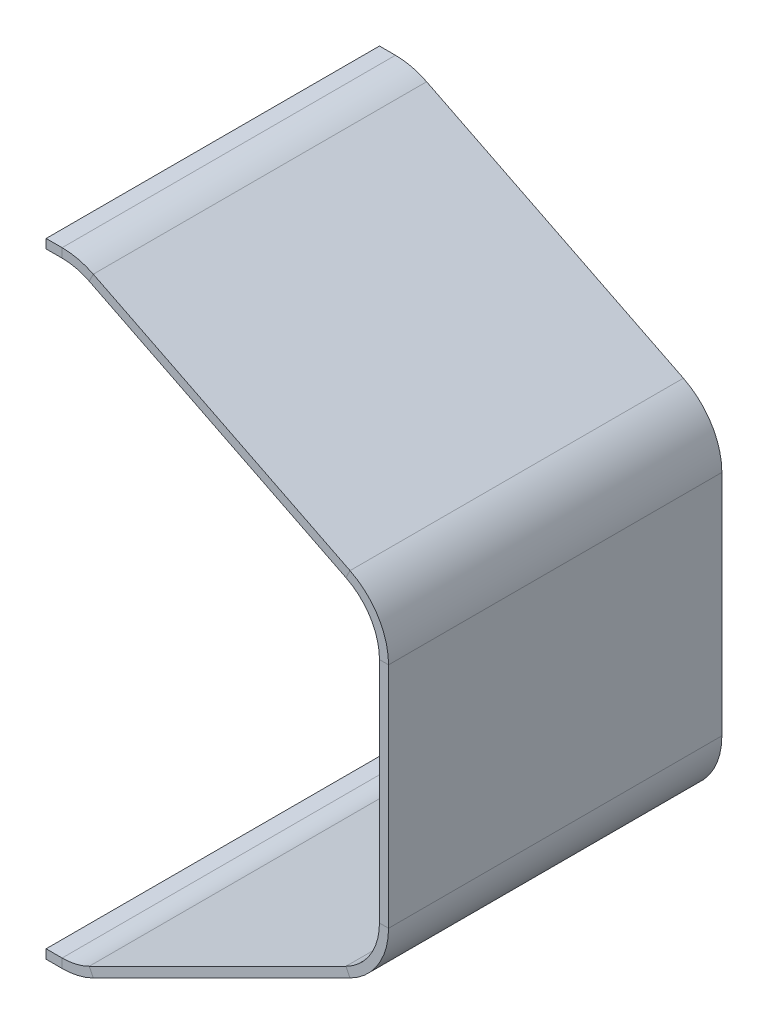
from build123d import *

# Parameters (mm, degrees)
BASE_FLANGE1_DEPTH = 55


# Sheet-metal steps are written as plain solids
with BuildPart() as part:
    # Sketch1 → Base-Flange1 (new body)
    with BuildSketch(Plane.XY):
        with BuildLine():
            Line((0, -50), (2.639320225, -50))
            ThreePointArc((2.639320225, -50), (4.93684943, -49.732489895), (7.11145618, -48.94427191))
            Line((7.11145618, -48.94427191), (49.472135955, -27.763932023))
            ThreePointArc((49.472135955, -27.763932023), (53.506508084, -24.076971234), (55, -18.819660113))
            Line((55, -18.819660113), (55, 18.819660113))
            ThreePointArc((55, 18.819660113), (53.506508084, 24.076971234), (49.472135955, 27.763932023))
            Line((49.472135955, 27.763932023), (7.11145618, 48.94427191))
            ThreePointArc((7.11145618, 48.94427191), (4.93684943, 49.732489895), (2.639320225, 50))
            Line((2.639320225, 50), (0, 50))
            Line((0, 50), (0, 51.5))
            Line((0, 51.5), (2.639320225, 51.5))
            ThreePointArc((2.639320225, 51.5), (5.281478811, 51.192363379), (7.782276573, 50.285912696))
            Line((7.782276573, 50.285912696), (50.142956348, 29.105572809))
            ThreePointArc((50.142956348, 29.105572809), (54.782484296, 24.865567902), (56.5, 18.819660113))
            Line((56.5, 18.819660113), (56.5, -18.819660113))
            ThreePointArc((56.5, -18.819660113), (54.782484296, -24.865567902), (50.142956348, -29.105572809))
            Line((50.142956348, -29.105572809), (7.782276573, -50.285912696))
            ThreePointArc((7.782276573, -50.285912696), (5.281478811, -51.192363379), (2.639320225, -51.5))
            Line((2.639320225, -51.5), (0, -51.5))
            Line((0, -51.5), (0, -50))
        make_face()
    extrude(amount=BASE_FLANGE1_DEPTH)


solid = part.part
